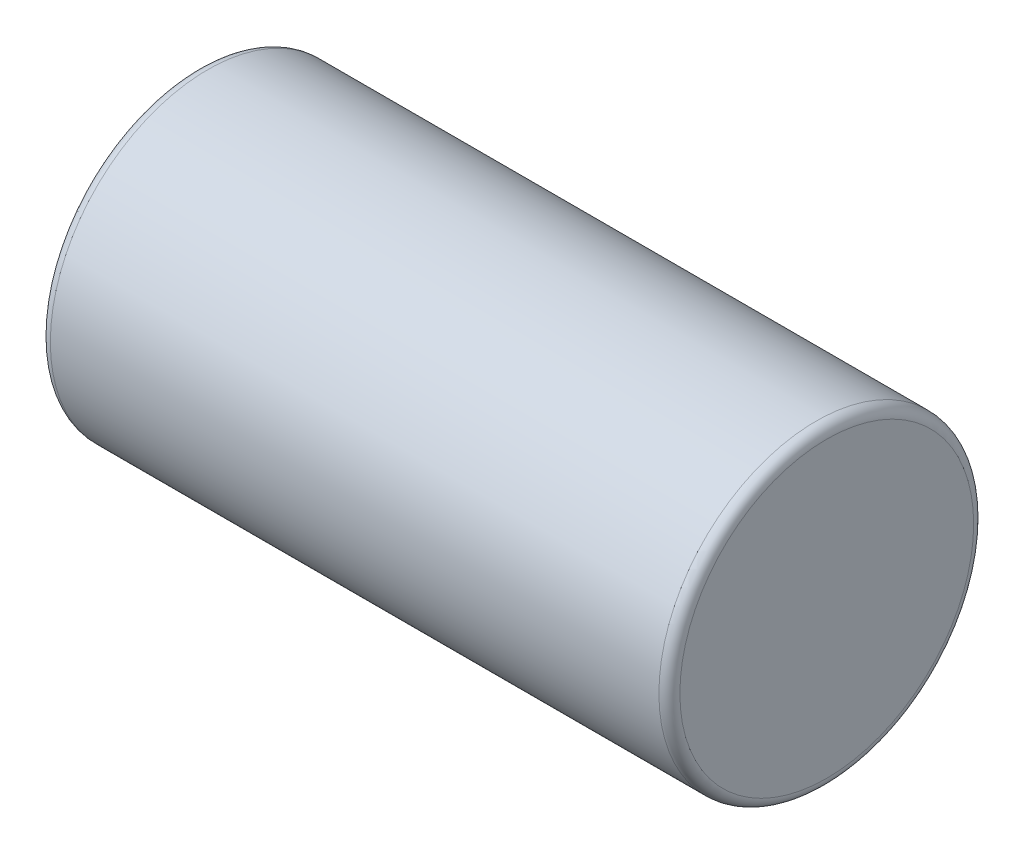
from build123d import *

# Parameters (mm, degrees)
SKETCH1_R           = 1.5
BOSS_EXTRUDE1_DEPTH = 3
FILLET1_R           = 0.1


with BuildPart() as part:
    # Sketch1 → Boss-Extrude1 (new, symmetric)
    with BuildSketch(Plane(origin=(0, 0, 0), x_dir=(0, 0, -1), z_dir=(1, 0, 0))):
        Circle(SKETCH1_R)
    extrude(amount=BOSS_EXTRUDE1_DEPTH, both=True)

    # Fillet1
    fillet1_edges = [part.edges().sort_by_distance(p)[0] for p in [
        (-3, 0, 1.5),
        (3, 0, 1.5),
    ]]
    fillet(fillet1_edges, radius=FILLET1_R)


solid = part.part
